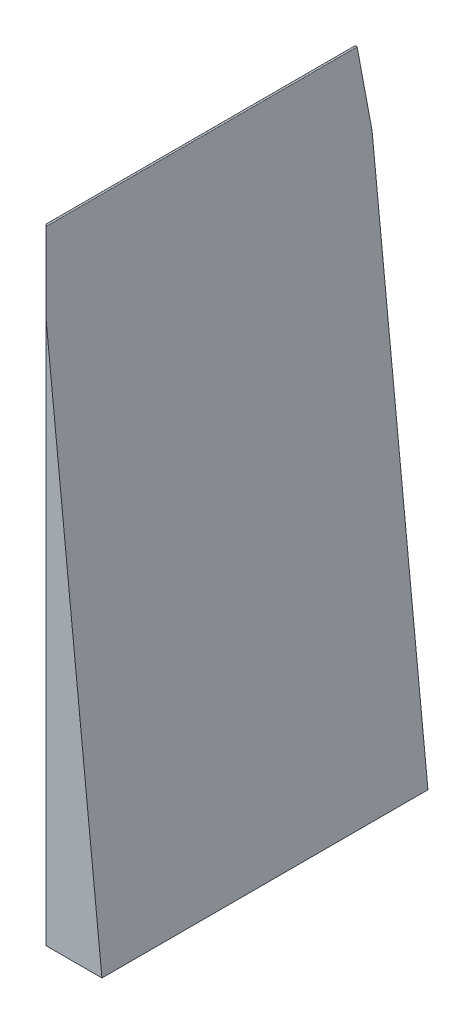
from build123d import *

# Parameters (mm, degrees)
BOSS_EXTRUDE1_DEPTH = 44.45
FILLET1_R           = 0.127
CHAMFER2_SIZE       = 1.27


with BuildPart() as part:
    # Sketch1 → Boss-Extrude1 (new body)
    with BuildSketch(Plane.XY):
        Polygon((0, 0), (0, 86.36), (8.89, 0), align=None)
    extrude(amount=BOSS_EXTRUDE1_DEPTH)

    # Fillet1
    fillet1_edges = [part.edges().sort_by_distance(p)[0] for p in [
        (0, 86.36, 22.225),
    ]]
    fillet(fillet1_edges, radius=FILLET1_R)

    # Chamfer2
    # the kernel refuses this chamfer: 1.27 mm, written as the material it takes off along each edge
    with BuildSketch(Plane(origin=(0, -3.266037395, 0), x_dir=(0, 0, 1), z_dir=(0, 1, 0))) as chamfer2_piece_1:
        Polygon((CHAMFER2_SIZE, 0), (0, CHAMFER2_SIZE), (0, 0), align=None)
    extrude(amount=90.418126679, mode=Mode.SUBTRACT)
    with BuildSketch(Plane(origin=(0, 0, -3.266037395), x_dir=(0, 1, 0), z_dir=(0, 0, 1))) as chamfer2_piece_2:
        Polygon((CHAMFER2_SIZE, 0), (0, -CHAMFER2_SIZE), (0, 0), align=None)
    extrude(amount=50.982074789, mode=Mode.SUBTRACT)
    with BuildSketch(Plane(origin=(0, -3.266037395, 44.45), x_dir=(0, 0, -1), z_dir=(0, 1, 0))) as chamfer2_piece_3:
        Polygon((CHAMFER2_SIZE, 0), (0, -CHAMFER2_SIZE), (0, 0), align=None)
    extrude(amount=90.418126679, mode=Mode.SUBTRACT)


solid = part.part
